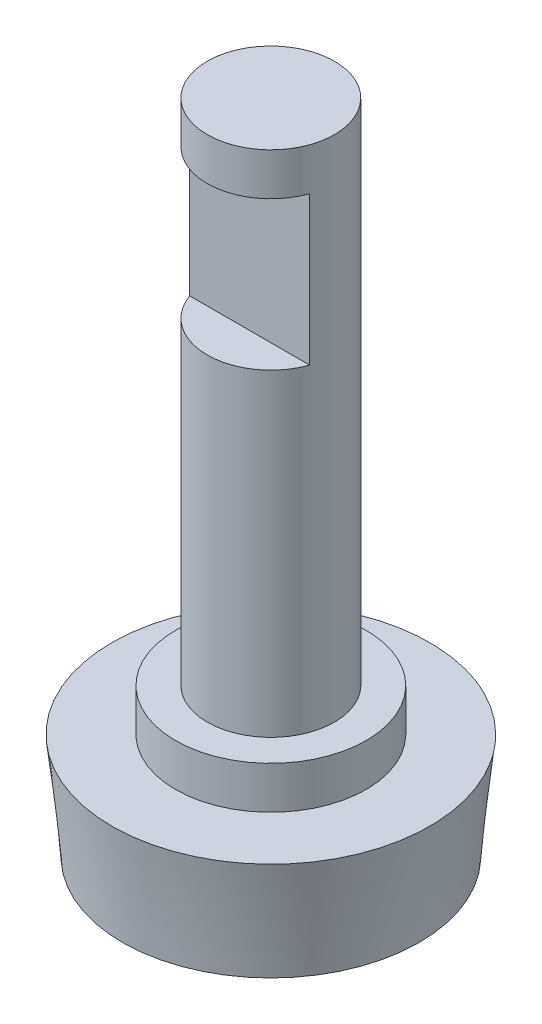
from build123d import *

# Parameters (mm, degrees)
SKETCH3_R           = 2.25
BOSS_EXTRUDE1_DEPTH = 1
SKETCH4_R           = 1.5
BOSS_EXTRUDE2_DEPTH = 12
CUT_EXTRUDE1_START  = -3.5
CUT_EXTRUDE1_DEPTH  = 3.5


with BuildPart() as part:
    # Loft1: read off the stored shape, not the designer's step
    # Loft1: loft between two sections, ruled curve by curve
    loft1_from = [
        Edge.make_bspline([(-1.450314533, 0, 3.185370897), (4.920427261, 0, 6.085999964), (7.821056328, 0, -0.28474183), (1.450314533, 0, -3.185370897), (-4.920427261, 0, -6.085999964), (-7.821056328, 0, 0.28474183), (-1.450314533, 0, 3.185370897)], [0, 0, 0, 0, 0.5, 0.5, 0.5, 1, 1, 1, 1], 3, [1, 0.333333333, 0.333333333, 1, 0.333333333, 0.333333333, 1]),
    ]
    loft1_to = [
        Edge.make_bspline([(-2.192741852, 2.5, 3.042101769), (3.891461686, 2.5, 7.427585472), (8.276945389, 2.5, 1.343381934), (2.192741852, 2.5, -3.042101769), (-3.891461686, 2.5, -7.427585472), (-8.276945389, 2.5, -1.343381934), (-2.192741852, 2.5, 3.042101769)], [0, 0, 0, 0, 0.5, 0.5, 0.5, 1, 1, 1, 1], 3, [1, 0.333333333, 0.333333333, 1, 0.333333333, 0.333333333, 1]),
    ]
    loft1 = Solid(Shell([*[Face.make_surface_from_curves(loft1_from[k], loft1_to[k]) for k in range(1)], Face(Wire(loft1_from)), Face(Wire(loft1_to))]))
    add(loft1)

    # Sketch3 → Boss-Extrude1 (add)
    with BuildSketch(Plane(origin=(0, 2.5, 0), x_dir=(1, 0, 0), z_dir=(0, 1, 0))):
        with Locations(Location((0, 0, 0), (0, 0, 270))):
            Circle(SKETCH3_R)
    extrude(amount=BOSS_EXTRUDE1_DEPTH)

    # Sketch4 → Boss-Extrude2 (add)
    with BuildSketch(Plane(origin=(0, 3.5, 0), x_dir=(1, 0, 0), z_dir=(0, 1, 0))):
        with Locations(Location((0, 0, 0), (0, 0, 270))):
            Circle(SKETCH4_R)
    extrude(amount=BOSS_EXTRUDE2_DEPTH)

    # Sketch5 → Cut-Extrude1 (cut)
    with BuildSketch(Plane(origin=(0, 14.5, 0), x_dir=(1, 0, 0), z_dir=(0, 1, 0)).offset(CUT_EXTRUDE1_START)):
        with BuildLine():
            Line((-1.414213562, -0.5), (1.414213562, -0.5))
            ThreePointArc((1.414213562, -0.5), (0, -1.5), (-1.414213562, -0.5))
        make_face()
    extrude(amount=CUT_EXTRUDE1_DEPTH, mode=Mode.SUBTRACT)


solid = part.part
